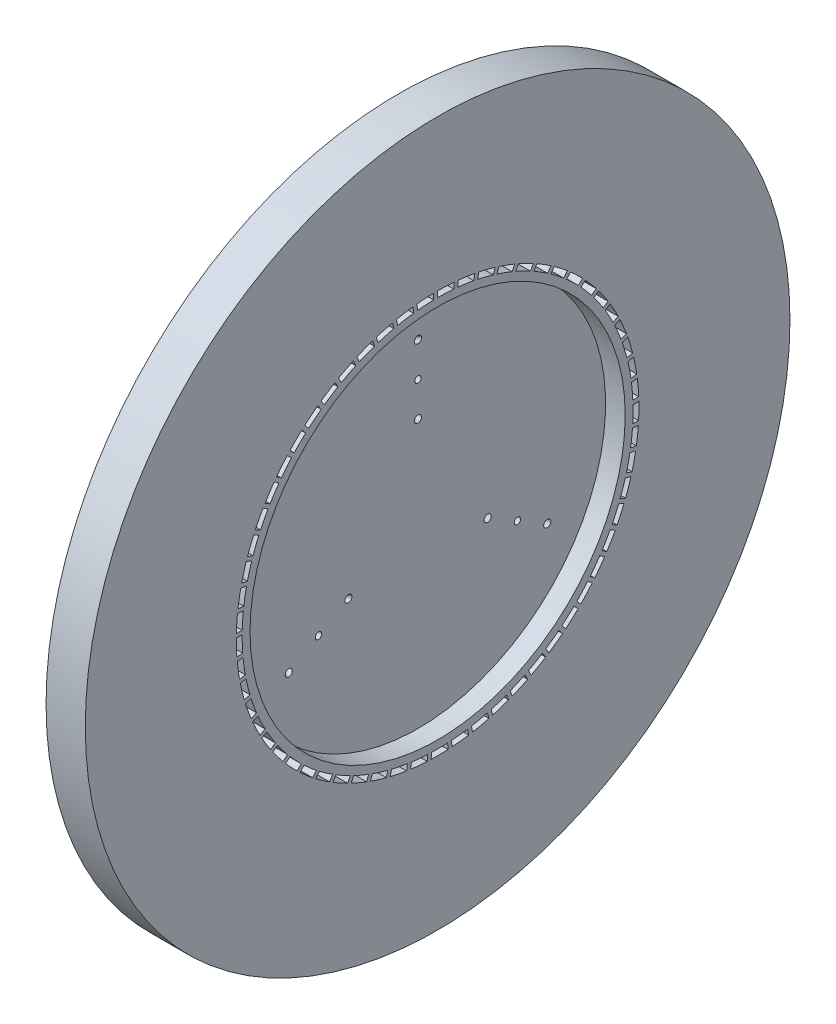
from build123d import *

# Parameters (mm, degrees)
SKETCH1_R                                = 89.825
SKETCH1_R_2                              = 47.825
FLANGE_DEPTH                             = 10
REGEN_SLOTS_DEPTH                        = 25
FACEPLATE_EXTRUSION_TO_MANIFOLD_SKETCH_R = 47.825
FACEPLATE_EXTRUSION_TO_MANIFOLD_DEPTH    = 5
FACEPLATE_START                          = 5
FACEPLATE_EXTRUSION_TO_CHAMBER_SKETCH_R  = 47.825
FACEPLATE_EXTRUSION_TO_CHAMBER_DEPTH     = 5
O_RING_SLOT_SKETCH_R                     = 47.825
O_RING_SLOT_SKETCH_R_2                   = 44.825
O_RING_SLOT_DEPTH                        = 6.5
FUEL_ORIFICES_SKETCH_R                   = 0.826210335
FUEL_ORIFICES_DEPTH                      = 128.91427305
OX1_PROFILE_R                            = 0.914623685
REVOLVE_OX_ORIFICE_1_COUNT               = 3
OX2_PROFILE_R                            = 0.914623685
REVOLVE_OX_ORIFICE_2_COUNT               = 3


with BuildPart() as part:
    # Sketch1 → Flange (new body)
    with BuildSketch(Plane(origin=(0, 0, 0), x_dir=(0, 0, -1), z_dir=(1, 0, 0))):
        Circle(SKETCH1_R)
        Circle(SKETCH1_R_2, mode=Mode.SUBTRACT)
    extrude(amount=FLANGE_DEPTH)

    # Regen Slots Sketch → Regen Slots (cut)
    with BuildSketch(Plane(origin=(10, 0, 0), x_dir=(0, 0, -1), z_dir=(1, 0, 0))):
        with BuildLine():
            Line((0, 51.325), (0, 49.825))
            ThreePointArc((0, 49.825), (2.065437599, 49.782171432), (4.127324381, 49.653759359))
            Line((4.127324381, 49.653759359), (4.281586042, 51.146100985))
            ThreePointArc((4.281586042, 51.146100985), (2.142660956, 51.280255743), (0, 51.325))
        make_face()
        with BuildLine():
            ThreePointArc((-5.123056182, 49.560921302), (-3.064161983, 49.730690085), (-1, 49.814963866))
            Line((-1, 49.814963866), (-1, 51.315257234))
            ThreePointArc((-1, 51.315257234), (-3.141382443, 51.228774545), (-5.277287678, 51.052971116))
            Line((-5.277287678, 51.052971116), (-5.123056182, 49.560921302))
        make_face()
        with BuildLine():
            Line((5.277287678, 51.052971116), (5.123056182, 49.560921302))
            ThreePointArc((5.123056182, 49.560921302), (7.17314303, 49.305949378), (9.210898098, 48.966212649))
            Line((9.210898098, 48.966212649), (9.517786206, 50.434783342))
            ThreePointArc((9.517786206, 50.434783342), (7.403991615, 50.788153473), (5.277287678, 51.052971116))
        make_face()
        with BuildLine():
            ThreePointArc((-10.191806695, 48.77148451), (-8.161280686, 49.152051051), (-6.116724133, 49.448117364))
            Line((-6.116724133, 49.448117364), (-6.270985793, 50.940458991))
            ThreePointArc((-6.270985793, 50.940458991), (-8.392126406, 50.634255592), (-10.498634794, 50.239768038))
            Line((-10.498634794, 50.239768038), (-10.191806695, 48.77148451))
        make_face()
        with BuildLine():
            Line((10.498634794, 50.239768038), (10.191806695, 48.77148451))
            ThreePointArc((10.191806695, 48.77148451), (12.204811359, 48.307071995), (14.196834003, 47.759611905))
            Line((14.196834003, 47.759611905), (14.653095469, 49.188844449))
            ThreePointArc((14.653095469, 49.188844449), (12.586838122, 49.757684141), (10.498634794, 50.239768038))
        make_face()
        with BuildLine():
            ThreePointArc((-15.152521521, 47.465057849), (-13.171887784, 48.052388049), (-11.168609468, 48.557108517))
            Line((-11.168609468, 48.557108517), (-11.475497576, 50.02567921))
            ThreePointArc((-11.475497576, 50.02567921), (-13.553911741, 49.503000934), (-15.608693769, 48.89401092))
            Line((-15.608693769, 48.89401092), (-15.152521521, 47.465057849))
        make_face()
        with BuildLine():
            Line((15.608693769, 48.89401092), (15.152521521, 47.465057849))
            ThreePointArc((15.152521521, 47.465057849), (17.107105652, 46.79612763), (19.032279936, 46.046747393))
            Line((19.032279936, 46.046747393), (19.633078274, 47.421491567))
            ThreePointArc((19.633078274, 47.421491567), (17.636261013, 48.19977098), (15.608693769, 48.89401092))
        make_face()
        with BuildLine():
            ThreePointArc((-19.952615849, 45.655489766), (-18.042869594, 46.443357779), (-16.102104764, 47.15138224))
            Line((-16.102104764, 47.15138224), (-16.55836623, 48.580614784))
            ThreePointArc((-16.55836623, 48.580614784), (-18.57202224, 47.847002152), (-20.553296708, 47.029965123))
            Line((-20.553296708, 47.029965123), (-19.952615849, 45.655489766))
        make_face()
        with BuildLine():
            Line((20.553296708, 47.029965123), (19.952615849, 45.655489766))
            ThreePointArc((19.952615849, 45.655489766), (21.828060369, 44.789132672), (23.665978967, 43.845775903))
            Line((23.665978967, 43.845775903), (24.404945566, 45.151459078))
            ThreePointArc((24.404945566, 45.151459078), (22.498735149, 46.130928255), (20.553296708, 47.029965123))
        make_face()
        with BuildLine():
            ThreePointArc((-24.541207486, 43.361962134), (-22.722592499, 44.342016363), (-20.864913745, 45.245839581))
            Line((-20.864913745, 45.245839581), (-21.465712083, 46.620583756))
            ThreePointArc((-21.465712083, 46.620583756), (-23.393264684, 45.683813243), (-25.280029588, 44.667389996))
            Line((-25.280029588, 44.667389996), (-24.541207486, 43.361962134))
        make_face()
        with BuildLine():
            Line((25.280029588, 44.667389996), (24.541207486, 43.361962134))
            ThreePointArc((24.541207486, 43.361962134), (26.317632217, 42.307361765), (28.048812733, 41.180028282))
            Line((28.048812733, 41.180028282), (28.918114364, 42.402809891))
            ThreePointArc((28.918114364, 42.402809891), (27.122717097, 43.573086215), (25.280029588, 44.667389996))
        make_face()
        with BuildLine():
            ThreePointArc((-28.869656218, 40.608786917), (-27.16145027, 41.770638543), (-25.406549449, 42.860679767))
            Line((-25.406549449, 42.860679767), (-26.145516048, 44.166362943))
            ThreePointArc((-26.145516048, 44.166362943), (-27.966532702, 43.03636455), (-29.738787865, 41.831329423))
            Line((-29.738787865, 41.831329423), (-28.869656218, 40.608786917))
        make_face()
        with BuildLine():
            Line((29.738787865, 41.831329423), (28.869656218, 40.608786917))
            ThreePointArc((28.869656218, 40.608786917), (30.528230615, 39.377122298), (32.134322107, 38.077762116))
            Line((32.134322107, 38.077762116), (33.124743955, 39.20468037))
            ThreePointArc((33.124743955, 39.20468037), (31.459191495, 40.553358621), (29.738787865, 41.831329423))
        make_face()
        with BuildLine():
            ThreePointArc((-32.892079412, 37.425148456), (-31.312389911, 38.756481562), (-29.678869408, 40.021186085))
            Line((-29.678869408, 40.021186085), (-30.548171039, 41.243967695))
            ThreePointArc((-30.548171039, 41.243967695), (-32.243348516, 39.932719685), (-33.882307593, 38.551846352))
            Line((-33.882307593, 38.551846352), (-32.892079412, 37.425148456))
        make_face()
        with BuildLine():
            Line((33.882307593, 38.551846352), (32.892079412, 37.425148456))
            ThreePointArc((32.892079412, 37.425148456), (34.415222175, 36.02947554), (35.879199672, 34.571862199))
            Line((35.879199672, 34.571862199), (36.98024302, 35.590971484))
            ThreePointArc((36.98024302, 35.590971484), (35.462190638, 37.103755338), (33.882307593, 38.551846352))
        make_face()
        with BuildLine():
            ThreePointArc((-36.565838382, 33.844794111), (-35.131410429, 35.331496236), (-33.636585968, 36.757457874))
            Line((-33.636585968, 36.757457874), (-34.627007817, 37.884376129))
            ThreePointArc((-34.627007817, 37.884376129), (-36.178376815, 36.405778059), (-37.666666432, 34.863704119))
            Line((-37.666666432, 34.863704119), (-36.565838382, 33.844794111))
        make_face()
        with BuildLine():
            Line((37.666666432, 34.863704119), (36.565838382, 33.844794111))
            ThreePointArc((36.565838382, 33.844794111), (37.937403818, 32.299907377), (39.243748795, 30.699491942))
            Line((39.243748795, 30.699491942), (40.443742309, 31.599989447))
            ThreePointArc((40.443742309, 31.599989447), (39.089281738, 33.260843017), (37.666666432, 34.863704119))
        make_face()
        with BuildLine():
            ThreePointArc((-39.851990369, 29.905676528), (-38.578029257, 31.53198826), (-37.23774635, 33.104091466))
            Line((-37.23774635, 33.104091466), (-38.338789698, 34.123200751))
            ThreePointArc((-38.338789698, 34.123200751), (-39.729905319, 32.492926128), (-41.051749236, 30.805997949))
            Line((-41.051749236, 30.805997949), (-39.851990369, 29.905676528))
        make_face()
        with BuildLine():
            Line((41.051749236, 30.805997949), (39.851990369, 29.905676528))
            ThreePointArc((39.851990369, 29.905676528), (41.057439543, 28.227952161), (42.192304418, 26.501699434))
            Line((42.192304418, 26.501699434), (43.478527869, 27.27403966))
            ThreePointArc((43.478527869, 27.27403966), (42.302016727, 29.065357486), (41.051749236, 30.805997949))
        make_face()
        with BuildLine():
            ThreePointArc((-42.715701344, 25.649551335), (-41.615711378, 27.398233364), (-40.444177356, 29.099813453))
            Line((-40.444177356, 29.099813453), (-41.64417087, 30.000310957))
            ThreePointArc((-41.64417087, 30.000310957), (-42.860286943, 28.235641096), (-44.001673286, 26.421740537))
            Line((-44.001673286, 26.421740537), (-42.715701344, 25.649551335))
        make_face()
        with BuildLine():
            Line((44.001673286, 26.421740537), (42.715701344, 25.649551335))
            ThreePointArc((42.715701344, 25.649551335), (43.742256194, 23.85677363), (44.693611118, 22.022982319))
            Line((44.693611118, 22.022982319), (46.052430217, 22.658978268))
            ThreePointArc((46.052430217, 22.658978268), (45.066339816, 24.561771935), (44.001673286, 26.421740537))
        make_face()
        with BuildLine():
            ThreePointArc((-45.126615258, 21.121534517), (-44.212256606, 22.974050379), (-43.221890021, 24.787070178))
            Line((-43.221890021, 24.787070178), (-44.508113472, 25.559410404))
            ThreePointArc((-44.508113472, 25.559410404), (-45.536338864, 23.679051245), (-46.485168653, 21.757406103))
            Line((-46.485168653, 21.757406103), (-45.126615258, 21.121534517))
        make_face()
        with BuildLine():
            Line((46.485168653, 21.757406103), (45.126615258, 21.121534517))
            ThreePointArc((45.126615258, 21.121534517), (45.963394049, 19.232707363), (46.721154422, 17.310816112))
            Line((46.721154422, 17.310816112), (48.138165348, 17.803726069))
            ThreePointArc((48.138165348, 17.803726069), (47.352948491, 19.797825492), (46.485168653, 21.757406103))
        make_face()
        with BuildLine():
            ThreePointArc((-47.059175824, 16.369624179), (-46.340140915, 18.306336744), (-45.5414399, 20.211577793))
            Line((-45.5414399, 20.211577793), (-46.900258998, 20.847573741))
            ThreePointArc((-46.900258998, 20.847573741), (-47.729694264, 18.871457561), (-48.475909667, 16.862437752))
            Line((-48.475909667, 16.862437752), (-47.059175824, 16.369624179))
        make_face()
        with BuildLine():
            Line((48.475909667, 16.862437752), (47.059175824, 16.369624179))
            ThreePointArc((47.059175824, 16.369624179), (47.697308492, 14.404769614), (48.253441866, 12.415150949))
            Line((48.253441866, 12.415150949), (49.713623951, 12.759749945))
            ThreePointArc((49.713623951, 12.759749945), (49.137604132, 14.824017173), (48.475909667, 16.862437752))
        make_face()
        with BuildLine():
            ThreePointArc((-48.49289742, 11.444191752), (-47.976808202, 13.444571386), (-47.378239186, 15.421837655))
            Line((-47.378239186, 15.421837655), (-48.795250112, 15.914747611))
            ThreePointArc((-48.795250112, 15.914747611), (-49.417103031, 13.863821731), (-49.95279398, 11.788723365))
            Line((-49.95279398, 11.788723365), (-48.49289742, 11.444191752))
        make_face()
        with BuildLine():
            Line((49.95279398, 11.788723365), (48.49289742, 11.444191752))
            ThreePointArc((48.49289742, 11.444191752), (48.925619599, 9.424137723), (49.274230822, 7.387882096))
            Line((49.274230822, 7.387882096), (50.762105773, 7.580517297))
            ThreePointArc((50.762105773, 7.580517297), (50.401388946, 9.693070584), (49.95279398, 11.788723365))
        make_face()
        with BuildLine():
            ThreePointArc((-49.412582239, 6.397448045), (-49.104909387, 8.440290227), (-48.71281735, 10.468622201))
            Line((-48.71281735, 10.468622201), (-50.172999435, 10.813221197))
            ThreePointArc((-50.172999435, 10.813221197), (-50.580678213, 8.709225942), (-50.90016625, 6.590045578))
            Line((-50.90016625, 6.590045578), (-49.412582239, 6.397448045))
        make_face()
        with BuildLine():
            Line((50.90016625, 6.590045578), (49.412582239, 6.397448045))
            ThreePointArc((49.412582239, 6.397448045), (49.635306968, 4.343607628), (49.772700674, 2.282299856))
            Line((49.772700674, 2.282299856), (51.272496646, 2.32092928))
            ThreePointArc((51.272496646, 2.32092928), (51.130906498, 4.459375036), (50.90016625, 6.590045578))
        make_face()
        with BuildLine():
            ThreePointArc((-49.808481394, 1.282889798), (-49.712486316, 3.346539891), (-49.531027533, 5.404436748))
            Line((-49.531027533, 5.404436748), (-51.018902483, 5.597071949))
            ThreePointArc((-51.018902483, 5.597071949), (-51.208085623, 3.462310191), (-51.307984095, 1.321511668))
            Line((-51.307984095, 1.321511668), (-49.808481394, 1.282889798))
        make_face()
        with BuildLine():
            Line((51.307984095, 1.321511668), (49.808481394, 1.282889798))
            ThreePointArc((49.808481394, 1.282889798), (49.818847734, -0.782965788), (49.743567516, -2.847475331))
            Line((49.743567516, -2.847475331), (51.239386299, -2.963261165))
            ThreePointArc((51.239386299, -2.963261165), (51.318423721, -0.821590997), (51.307984095, 1.321511668))
        make_face()
        with BuildLine():
            ThreePointArc((-49.676398255, -3.8452674), (-49.793098524, -1.7826846), (-49.824196501, 0.282962921))
            Line((-49.824196501, 0.282962921), (-51.323992473, 0.321592345))
            ThreePointArc((-51.323992473, 0.321592345), (-51.292674586, -1.821306909), (-51.171924545, -3.961030594))
            Line((-51.171924545, -3.961030594), (-49.676398255, -3.8452674))
        make_face()
        with BuildLine():
            Line((51.171924545, -3.961030594), (49.676398255, -3.8452674))
            ThreePointArc((49.676398255, -3.8452674), (49.474296322, -5.901239572), (49.187140168, -7.947066571))
            Line((49.187140168, -7.947066571), (50.66312571, -8.216040304))
            ThreePointArc((50.66312571, -8.216040304), (50.961952887, -6.093847961), (51.171924545, -3.961030594))
        make_face()
        with BuildLine():
            ThreePointArc((-49.017732937, -8.932663808), (-49.3458915, -6.89301219), (-49.589216592, -4.841510384))
            Line((-49.589216592, -4.841510384), (-51.085035374, -4.957296218))
            ThreePointArc((-51.085035374, -4.957296218), (-50.833548438, -7.085617702), (-50.493429865, -9.201584946))
            Line((-50.493429865, -9.201584946), (-49.017732937, -8.932663808))
        make_face()
        with BuildLine():
            Line((50.493429865, -9.201584946), (49.017732937, -8.932663808))
            ThreePointArc((49.017732937, -8.932663808), (48.60530506, -10.956958749), (48.109316898, -12.962416928))
            Line((48.109316898, -12.962416928), (49.549823386, -13.381727372))
            ThreePointArc((49.549823386, -13.381727372), (50.065272674, -11.301508621), (50.493429865, -9.201584946))
        make_face()
        with BuildLine():
            ThreePointArc((-47.839467456, -13.925371756), (-48.375605751, -11.930272137), (-48.828578651, -9.914662474))
            Line((-48.828578651, -9.914662474), (-50.304564193, -10.183636207))
            ThreePointArc((-50.304564193, -10.183636207), (-49.835574031, -12.274819185), (-49.279692266, -14.344600209))
            Line((-49.279692266, -14.344600209), (-47.839467456, -13.925371756))
        make_face()
        with BuildLine():
            Line((49.279692266, -14.344600209), (47.839467456, -13.925371756))
            ThreePointArc((47.839467456, -13.925371756), (47.221085473, -15.896531437), (46.521522901, -17.840362441))
            Line((46.521522901, -17.840362441), (47.911280607, -18.405564801))
            ThreePointArc((47.911280607, -18.405564801), (48.637888116, -16.389370478), (49.279692266, -14.344600209))
        make_face()
        with BuildLine():
            ThreePointArc((-46.154091718, -18.7704673), (-46.892526546, -16.841068231), (-47.550345628, -14.882716675))
            Line((-47.550345628, -14.882716675), (-48.990852116, -15.302027119))
            ThreePointArc((-48.990852116, -15.302027119), (-48.309330141, -17.333904532), (-47.543577671, -19.335559141))
            Line((-47.543577671, -19.335559141), (-46.154091718, -18.7704673))
        make_face()
        with BuildLine():
            Line((47.543577671, -19.335559141), (46.154091718, -18.7704673))
            ThreePointArc((46.154091718, -18.7704673), (45.336310633, -20.667596938), (44.440589187, -22.529195674))
            Line((44.440589187, -22.529195674), (45.764866334, -23.234298664))
            ThreePointArc((45.764866334, -23.234298664), (46.694929844, -21.30350093), (47.543577671, -19.335559141))
        make_face()
        with BuildLine():
            ThreePointArc((-43.979471127, -23.416591221), (-44.912374894, -21.573344812), (-45.768067113, -19.693010377))
            Line((-45.768067113, -19.693010377), (-47.157824819, -20.258212737))
            ThreePointArc((-47.157824819, -20.258212737), (-46.270995334, -22.209246178), (-45.303489324, -24.121556336))
            Line((-45.303489324, -24.121556336), (-43.979471127, -23.416591221))
        make_face()
        with BuildLine():
            Line((45.303489324, -24.121556336), (43.979471127, -23.416591221))
            ThreePointArc((43.979471127, -23.416591221), (42.970959622, -25.219580769), (41.888574173, -26.979213828))
            Line((41.888574173, -26.979213828), (43.133333094, -27.816743182))
            ThreePointArc((43.133333094, -27.816743182), (44.256993699, -25.991808973), (45.303489324, -24.121556336))
        make_face()
        with BuildLine():
            ThreePointArc((-41.3386572, -27.81449345), (-42.456140895, -26.076938572), (-43.500635701, -24.29455327))
            Line((-43.500635701, -24.29455327), (-44.824912848, -24.999656261))
            ThreePointArc((-44.824912848, -24.999656261), (-43.742176466, -26.849164289), (-42.583172721, -28.651859033))
            Line((-42.583172721, -28.651859033), (-41.3386572, -27.81449345))
        make_face()
        with BuildLine():
            Line((42.583172721, -28.651859033), (41.3386572, -27.81449345))
            ThreePointArc((41.3386572, -27.81449345), (40.150105749, -29.50423077), (38.892529852, -31.143245604))
            Line((38.892529852, -31.143245604), (40.044575792, -32.104323301))
            ThreePointArc((40.044575792, -32.104323301), (41.349922412, -30.404597375), (42.583172721, -28.651859033))
        make_face()
        with BuildLine():
            ThreePointArc((-38.259643224, -31.917555129), (-39.549861241, -30.304110295), (-40.772086729, -28.638567855))
            Line((-40.772086729, -28.638567855), (-42.01684565, -29.476097209))
            ThreePointArc((-42.01684565, -29.476097209), (-40.749679645, -31.20447458), (-39.411463893, -32.878444897))
            Line((-39.411463893, -32.878444897), (-38.259643224, -31.917555129))
        make_face()
        with BuildLine():
            Line((39.411463893, -32.878444897), (38.259643224, -31.917555129))
            ThreePointArc((38.259643224, -31.917555129), (36.903650767, -33.476128585), (35.484215039, -34.977151229))
            Line((35.484215039, -34.977151229), (36.531336025, -36.051589607))
            ThreePointArc((36.531336025, -36.051589607), (38.00453166, -34.495089481), (39.411463893, -32.878444897))
        make_face()
        with BuildLine():
            ThreePointArc((-34.775067511, -35.682282783), (-36.224343219, -34.210050911), (-37.611343494, -32.679006496))
            Line((-37.611343494, -32.679006496), (-38.763389435, -33.640084193))
            ThreePointArc((-38.763389435, -33.640084193), (-37.325226083, -35.229009678), (-35.821983743, -36.756511065))
            Line((-35.821983743, -36.756511065), (-34.775067511, -35.682282783))
        make_face()
        with BuildLine():
            Line((35.821983743, -36.756511065), (34.775067511, -35.682282783))
            ThreePointArc((34.775067511, -35.682282783), (33.266007906, -37.09317111), (31.699758719, -38.44029035))
            Line((31.699758719, -38.44029035), (32.630855008, -39.616700095))
            ThreePointArc((32.630855008, -39.616700095), (34.256283418, -38.219925057), (35.821983743, -36.756511065))
        make_face()
        with BuildLine():
            ThreePointArc((-30.921867432, -39.068769363), (-32.514838148, -37.753356476), (-34.051910662, -36.373039538))
            Line((-34.051910662, -36.373039538), (-35.099031649, -37.447477917))
            ThreePointArc((-35.099031649, -37.447477917), (-33.505115839, -38.880108508), (-31.852781655, -40.244949073))
            Line((-31.852781655, -40.244949073), (-30.921867432, -39.068769363))
        make_face()
        with BuildLine():
            Line((31.852781655, -40.244949073), (30.921867432, -39.068769363))
            ThreePointArc((30.921867432, -39.068769363), (29.275737086, -40.317016793), (27.579277071, -41.49595283))
            Line((27.579277071, -41.49595283), (28.384478811, -42.761863706))
            ThreePointArc((28.384478811, -42.761863706), (30.14491005, -41.53961992), (31.852781655, -40.244949073))
        make_face()
        with BuildLine():
            ThreePointArc((-26.740887866, -42.041117268), (-28.460667703, -40.896467071), (-30.131519106, -39.681509313))
            Line((-30.131519106, -39.681509313), (-31.062615395, -40.857919059))
            ThreePointArc((-31.062615395, -40.857919059), (-29.329843032, -42.119068517), (-27.545932157, -43.306780608))
            Line((-27.545932157, -43.306780608), (-26.740887866, -42.041117268))
        make_face()
        with BuildLine():
            Line((27.545932157, -43.306780608), (26.740887866, -42.041117268))
            ThreePointArc((26.740887866, -42.041117268), (24.97513617, -43.113492068), (23.166448225, -44.111747887))
            Line((23.166448225, -44.111747887), (23.837220077, -45.453740924))
            ThreePointArc((23.837220077, -45.453740924), (25.713993136, -44.418984477), (27.545932157, -43.306780608))
        make_face()
        with BuildLine():
            ThreePointArc((-22.276448235, -44.567818872), (-24.104807101, -43.606064941), (-25.891725951, -42.569345218))
            Line((-25.891725951, -42.569345218), (-26.696927691, -43.835256094))
            ThreePointArc((-26.696927691, -43.835256094), (-24.843666592, -44.911555921), (-22.947088925, -45.909549495))
            Line((-22.947088925, -45.909549495), (-22.276448235, -44.567818872))
        make_face()
        with BuildLine():
            Line((22.947088925, -45.909549495), (22.276448235, -44.567818872))
            ThreePointArc((22.276448235, -44.567818872), (20.409792597, -45.452953602), (18.508049264, -46.259947443))
            Line((18.508049264, -46.259947443), (19.03728088, -47.663797181))
            ThreePointArc((19.03728088, -47.663797181), (21.010501499, -46.827496749), (22.947088925, -45.909549495))
        make_face()
        with BuildLine():
            ThreePointArc((-17.575872712, -46.622090509), (-19.493429546, -45.853427675), (-21.37747406, -45.005935473))
            Line((-21.37747406, -45.005935473), (-22.048245913, -46.34792851))
            ThreePointArc((-22.048245913, -46.34792851), (-20.094141106, -47.22796966), (-18.105000842, -48.025665737))
            Line((-18.105000842, -48.025665737), (-17.575872712, -46.622090509))
        make_face()
        with BuildLine():
            Line((18.105000842, -48.025665737), (17.575872712, -46.622090509))
            ThreePointArc((17.575872712, -46.622090509), (15.628100145, -47.31060252), (13.653460377, -47.917780048))
            Line((13.653460377, -47.917780048), (14.03554177, -49.36860533))
            ThreePointArc((14.03554177, -49.36860533), (16.084293318, -48.739625906), (18.105000842, -48.025665737))
        make_face()
        with BuildLine():
            ThreePointArc((-12.688988566, -48.182156388), (-14.675416789, -47.614732668), (-16.636615626, -46.965451616))
            Line((-16.636615626, -46.965451616), (-17.165847242, -48.369301354))
            ThreePointArc((-17.165847242, -48.369301354), (-15.131612725, -49.043755172), (-13.070995246, -49.632697975))
            Line((-13.070995246, -49.632697975), (-12.688988566, -48.182156388))
        make_face()
        with BuildLine():
            Line((13.070995246, -49.632697975), (12.688988566, -48.182156388))
            ThreePointArc((12.688988566, -48.182156388), (10.680745944, -48.666747283), (8.654141414, -49.067672264))
            Line((8.654141414, -49.067672264), (8.885022426, -50.550093981))
            ThreePointArc((8.885022426, -50.550093981), (10.987587627, -50.135102903), (13.070995246, -49.632697975))
        make_face()
        with BuildLine():
            ThreePointArc((-7.667597984, -49.231479423), (-9.701840963, -48.87130965), (-11.719404928, -48.427122288))
            Line((-11.719404928, -48.427122288), (-12.10148632, -49.87794757))
            ThreePointArc((-12.10148632, -49.87794757), (-10.008685486, -50.339664678), (-7.898433849, -50.713611267))
            Line((-7.898433849, -50.713611267), (-7.667597984, -49.231479423))
        make_face()
        with BuildLine():
            Line((7.898433849, -50.713611267), (7.667597984, -49.231479423))
            ThreePointArc((7.667597984, -49.231479423), (5.620173179, -49.507012417), (3.563086399, -49.697434947))
            Line((3.563086399, -49.697434947), (3.640319633, -51.195739061))
            ThreePointArc((3.640319633, -51.195739061), (5.774410774, -50.999135338), (7.898433849, -50.713611267))
        make_face()
        with BuildLine():
            ThreePointArc((-2.564928956, -49.758936529), (-4.62542321, -49.609838592), (-6.677965622, -49.375453417))
            Line((-6.677965622, -49.375453417), (-6.908846633, -50.857875135))
            ThreePointArc((-6.908846633, -50.857875135), (-4.77966369, -51.101961215), (-2.642147089, -51.256947663))
            Line((-2.642147089, -51.256947663), (-2.564928956, -49.758936529))
        make_face()
        with BuildLine():
            Line((2.642147089, -51.256947663), (2.564928956, -49.758936529))
            ThreePointArc((2.564928956, -49.758936529), (0.50002518, -49.822490903), (-1.565738219, -49.800392457))
            Line((-1.565738219, -49.800392457), (-1.642971453, -51.29869657))
            ThreePointArc((-1.642971453, -51.29869657), (0.50002373, -51.322564251), (2.642147089, -51.256947663))
        make_face()
    extrude(amount=-REGEN_SLOTS_DEPTH, mode=Mode.SUBTRACT)



with BuildPart() as body_2:
    # Faceplate Extrusion to Manifold Sketch → Faceplate Extrusion to Manifold (new body)
    with BuildSketch(Plane.ZY):
        Circle(FACEPLATE_EXTRUSION_TO_MANIFOLD_SKETCH_R)
    extrude(amount=-FACEPLATE_EXTRUSION_TO_MANIFOLD_DEPTH)


with BuildPart() as part_1:
    add(part.part)

    add(body_2.part)  # Faceplate Extrusion to Chamber merges body 2
    # Faceplate Extrusion to Chamber Sketch → Faceplate Extrusion to Chamber (add)
    with BuildSketch(Plane.ZY.offset(FACEPLATE_START)):
        Circle(FACEPLATE_EXTRUSION_TO_CHAMBER_SKETCH_R)
    extrude(amount=-FACEPLATE_EXTRUSION_TO_CHAMBER_DEPTH)

    # O-Ring Slot Sketch → O-Ring Slot (cut)
    with BuildSketch(Plane.ZY.offset(5)):
        Circle(O_RING_SLOT_SKETCH_R)
        Circle(O_RING_SLOT_SKETCH_R_2, mode=Mode.SUBTRACT)
    extrude(amount=-O_RING_SLOT_DEPTH, mode=Mode.SUBTRACT)

    # Fuel Orifices Sketch → Fuel Orifices (cut, through all)
    with BuildSketch(Plane.ZY.offset(5)):
        with Locations((0, 29.2826)):
            Circle(FUEL_ORIFICES_SKETCH_R)
        with Locations((25.359475489, -14.6413)):
            Circle(FUEL_ORIFICES_SKETCH_R)
        with Locations((-25.359475489, -14.6413)):
            Circle(FUEL_ORIFICES_SKETCH_R)
    extrude(amount=-FUEL_ORIFICES_DEPTH, mode=Mode.SUBTRACT)

    # Ox1 Orifice 1: sweep along a path in Ox1 Guide Curve
    with BuildLine(Plane(origin=(0, 0, 0), x_dir=(1, 0, 0), z_dir=(0, 0.8660254037844387, 0.4999999999999998))) as ox1_orifice_1_path:
        Line((-5, -32.2826), (5, -38.056102692))
    # Ox1 Profile → Ox1 Orifice 1 (sweep, cut)
    with BuildSketch(Plane.ZY.offset(5)):
        with Locations((27.9575517, -16.1413)):
            Circle(OX1_PROFILE_R)
    ox1_orifice_1 = sweep(path=ox1_orifice_1_path.line, mode=Mode.SUBTRACT)

    # Revolve Ox Orifice 1: Ox1 Orifice 1 ×3 about axis
    revolve_ox_orifice_1_axis = Axis((5, 0, 0), (-1, 0, 0))
    for i in range(1, REVOLVE_OX_ORIFICE_1_COUNT):
        add(ox1_orifice_1.rotate(revolve_ox_orifice_1_axis, i * 360 / REVOLVE_OX_ORIFICE_1_COUNT), mode=Mode.SUBTRACT)

    # Ox Orifice 2: sweep along a path in Ox2 Guide Curve
    with BuildLine(Plane(origin=(0, 0, 0), x_dir=(1, 0, 0), z_dir=(0, 0.8660254037844387, 0.4999999999999998))) as ox_orifice_2_path:
        Line((-5, -26.2826), (5, -20.509097308))
    # Ox2 Profile → Ox Orifice 2 (sweep, cut)
    with BuildSketch(Plane.ZY.offset(5)):
        with Locations((22.761399278, -13.1413)):
            Circle(OX2_PROFILE_R)
    ox_orifice_2 = sweep(path=ox_orifice_2_path.line, mode=Mode.SUBTRACT)

    # Revolve Ox Orifice 2: Ox Orifice 2 ×3 about axis
    revolve_ox_orifice_2_axis = Axis((5, 0, 0), (-1, 0, 0))
    for i in range(1, REVOLVE_OX_ORIFICE_2_COUNT):
        add(ox_orifice_2.rotate(revolve_ox_orifice_2_axis, i * 360 / REVOLVE_OX_ORIFICE_2_COUNT), mode=Mode.SUBTRACT)


solid = part_1.part
